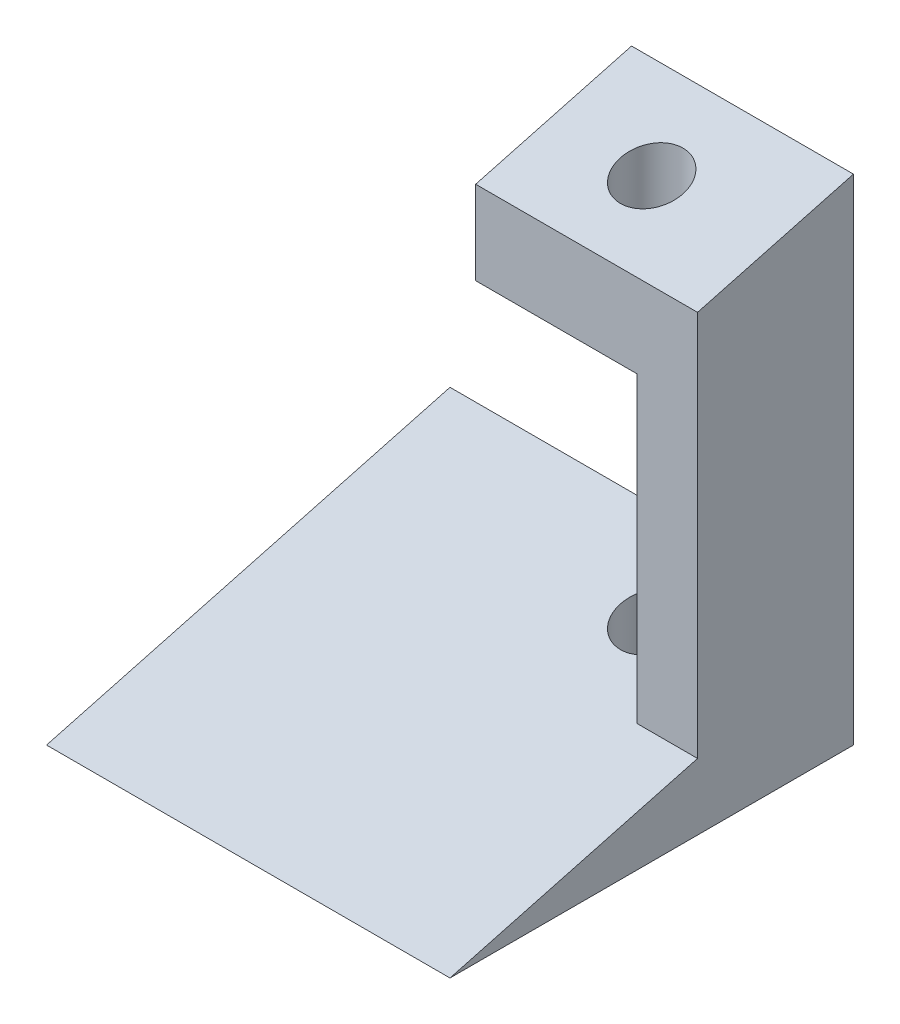
from build123d import *

# Parameters (mm, degrees)
EXTRUDE_3_DEPTH     = 20
EXTRUDE_START       = -3
EXTRUDE_4_DEPTH     = 3
EXTRUDE_7_DEPTH     = 8
SKETCH_13_R         = 1.55
CUT_EXTRUDE_2_DEPTH = 30


# Read off the part's stored shape, not the designer's step: 凸台-拉伸4
with BuildPart() as part:
    # 草图3 → 凸台-拉伸3 (new body)
    with BuildSketch(Plane(origin=(0, 0, 0), x_dir=(0, 0, -1), z_dir=(1, 0, 0))):
        Polygon((0, 0), (20, 0), (20, 5.358983849), align=None)
    extrude(amount=EXTRUDE_3_DEPTH)

    # 凸台-拉伸4 outline → 凸台-拉伸4 (add)
    with BuildSketch(Plane(origin=(20, 0, 0), x_dir=(0, 0, -1), z_dir=(1, 0, 0)).offset(EXTRUDE_START)):
        Polygon((20, 5.358983849), (20, 24.511593186), (12.27259339, 22.441040825), (12.27259339, 3.288431488), align=None)
    extrude(amount=EXTRUDE_4_DEPTH)

    # 草图9 → 凸台-拉伸7 (add)
    with BuildSketch(Plane.ZY.offset(-17)):
        Polygon((-20, 24.511593186), (-12.27259339, 22.441040825), (-12.27259339, 18.299936104), (-20, 20.370488465), align=None)
    extrude(amount=EXTRUDE_7_DEPTH)

    # 草图13 → 切除-拉伸2 (cut)
    with BuildSketch(Plane.XZ):
        with Locations(Location((14, -16, 0), (0, 0, 90))):
            Circle(SKETCH_13_R)
    extrude(amount=-CUT_EXTRUDE_2_DEPTH, mode=Mode.SUBTRACT)


solid = part.part
